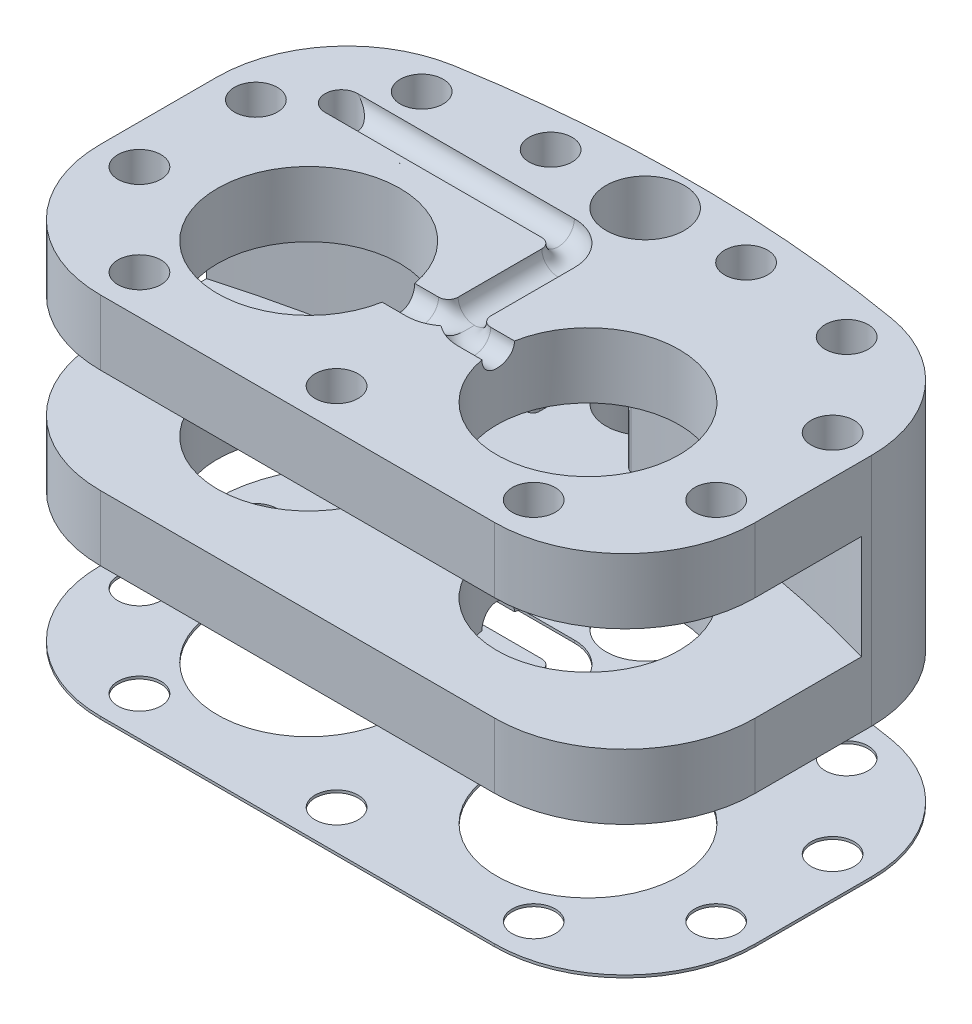
from build123d import *

# Parameters (mm, degrees)
BOSS_EXTRUDE1_DEPTH             = 5
F_12_0MM_DOWEL_HOLE1_D          = 14
BOSS_EXTRUDE2_DEPTH             = 4
F_6_0MM_DOWEL_HOLE1_D           = 6
SKETCH13_R                      = 1.25
SKETCH13_4_R                    = 1.25
FILLET1_R                       = 10
M4X0_7_TAPPED_HOLE1_AT_2_COUNT  = 2
M4X0_7_TAPPED_HOLE1_AT_2_PITCH  = 25.073446611
M4X0_7_TAPPED_HOLE1_AT_3_COUNT  = 2
M4X0_7_TAPPED_HOLE1_AT_3_PITCH  = 32.930809617
M4X0_7_TAPPED_HOLE1_AT_4_COUNT  = 2
M4X0_7_TAPPED_HOLE1_AT_4_PITCH  = 25.111924527
M4X0_7_TAPPED_HOLE1_AT_5_COUNT  = 2
M4X0_7_TAPPED_HOLE1_AT_5_PITCH  = 22.370502293
M4X0_7_TAPPED_HOLE1_AT_6_COUNT  = 2
M4X0_7_TAPPED_HOLE1_AT_6_PITCH  = 16.667429732
M4X0_7_TAPPED_HOLE1_AT_7_COUNT  = 2
M4X0_7_TAPPED_HOLE1_AT_7_PITCH  = 8.870903554
M4X0_7_TAPPED_HOLE1_AT_8_COUNT  = 2
M4X0_7_TAPPED_HOLE1_AT_8_PITCH  = 23.828688167
M4X0_7_TAPPED_HOLE1_AT_9_COUNT  = 2
M4X0_7_TAPPED_HOLE1_AT_9_PITCH  = 30.686033996
M4X0_7_TAPPED_HOLE1_AT_10_COUNT = 2
M4X0_7_TAPPED_HOLE1_AT_10_PITCH = 34.121383931
M4X0_7_TAPPED_HOLE1_AT_11_COUNT = 2
M4X0_7_TAPPED_HOLE1_AT_11_PITCH = 15
FILLET2_R                       = 0.5
THICKEN1_START                  = -10.2
THICKEN1_OUTLINE_R              = 1.65
THICKEN1_OUTLINE_R_2            = 3
THICKEN1_DEPTH                  = 0.2
SKETCH14_W                      = 6
SKETCH14_H                      = 4
CUT_EXTRUDE1_DEPTH              = 10
FILLET3_R                       = 1


# Read off the part's stored shape, not the designer's step: Thicken1
with BuildPart() as part:
    # Sketch2 → Boss-Extrude1 (new body)
    with BuildSketch(Plane(origin=(0, 0, 0), x_dir=(1, 0, 0), z_dir=(0, 1, 0))):
        with BuildLine():
            Line((-25.127648951, 69.819630142), (25.127648951, 69.819630142))
            Line((25.127648951, 69.819630142), (25.127648951, 96.828075976))
            ThreePointArc((25.127648951, 96.828075976), (0, 100.035368941), (-25.127648951, 96.828075976))
            Line((-25.127648951, 96.828075976), (-25.127648951, 69.819630142))
        make_face()
    boss_extrude1 = extrude(amount=BOSS_EXTRUDE1_DEPTH)

    # Ø12.0mm Dowel Hole1 (through all)
    with Locations(Plane(origin=(0, 5, 0), x_dir=(1, 0, 0), z_dir=(0, 1, 0))):
        with Locations((-10.716200381, 81.397623119), (10.716200381, 81.397623119)):
            f_12_0mm_dowel_hole1 = Hole(F_12_0MM_DOWEL_HOLE1_D / 2)

    # Sketch6 → Boss-Extrude2 (add)
    with BuildSketch(Plane(origin=(0, 5, 0), x_dir=(1, 0, 0), z_dir=(0, 1, 0))):
        with BuildLine():
            Line((-3.535368944, 91.431674853), (-3.535368944, 99.972877349))
            ThreePointArc((-3.535368944, 99.972877349), (-14.417509932, 98.990961438), (-25.127648951, 96.828075976))
            Line((-25.127648951, 96.828075976), (-25.127648951, 87.982107603))
            ThreePointArc((-25.127648951, 87.982107603), (-14.434923875, 90.354208384), (-3.535368944, 91.431674853))
        make_face()
        with BuildLine():
            Line((3.535368944, 91.431674853), (3.535368944, 99.972877349))
            ThreePointArc((3.535368944, 99.972877349), (14.417509932, 98.990961438), (25.127648951, 96.828075976))
            Line((25.127648951, 96.828075976), (25.127648951, 87.982107603))
            ThreePointArc((25.127648951, 87.982107603), (14.434923875, 90.354208384), (3.535368944, 91.431674853))
        make_face()
    boss_extrude2 = extrude(amount=BOSS_EXTRUDE2_DEPTH)

    # Ø6.0mm Dowel Hole1 (through all)
    with Locations(Plane(origin=(0, 5, 0), x_dir=(1, 0, 0), z_dir=(0, 1, 0))):
        with Locations((0, 96.5)):
            f_6_0mm_dowel_hole1 = Hole(F_6_0MM_DOWEL_HOLE1_D / 2)

    # Cut-Sweep6: sweep along a curve in space
    with BuildLine() as cut_sweep6_path:
        Line((2, 0, -81.397623119), (10.716200381, 0, -81.397623119))
        ThreePointArc((0, 0, -83.397623119), (0.585786438, 0, -81.983409556), (2, 0, -81.397623119))
        Line((0, 0, -89.819630142), (0, 0, -83.397623119))
        ThreePointArc((-2, 0, -91.819630142), (-0.585786438, 0, -91.233843704), (0, 0, -89.819630142))
        Line((-18.627648951, 0, -91.819630142), (-2, 0, -91.819630142))
        Line((-18.627648951, 0, -91.819630142), (-18.627648951, 9, -91.819630142))
        Line((-18.627648951, 9, -91.819630142), (-25.127648951, 9, -96.828075976))
    # Sketch13 → Cut-Sweep6 (sweep, cut)
    with BuildSketch(Plane(origin=(-13.627648951, 0, 0), x_dir=(0, 0, -1), z_dir=(1, 0, 0))):
        with Locations((91.819630142, 0)):
            Circle(SKETCH13_R)
    cut_sweep6 = sweep(path=cut_sweep6_path.line, transition=Transition.RIGHT, mode=Mode.SUBTRACT)

    # Cut-Sweep7: sweep along a path in Sketch9
    with BuildLine(Plane.XZ) as cut_sweep7_path:
        Line((-10.716200381, -81.397623119), (-2, -81.397623119))
        ThreePointArc((-2, -81.397623119), (-0.585786438, -81.983409556), (0, -83.397623119))
        Line((0, -83.397623119), (0, -89.819630142))
        ThreePointArc((0, -89.819630142), (-0.585786438, -91.233843704), (-2, -91.819630142))
        Line((-2, -91.819630142), (-18.627648951, -91.819630142))
    # Sketch13<4> → Cut-Sweep7 (sweep, cut)
    with BuildSketch(Plane(origin=(-13.627648951, 0, 0), x_dir=(0, 0, -1), z_dir=(1, 0, 0))):
        with Locations((91.819630142, 0)):
            Circle(SKETCH13_4_R)
    cut_sweep7 = sweep(path=cut_sweep7_path.line, mode=Mode.SUBTRACT)

    # Mirror5: Boss-Extrude2 across plane
    add(boss_extrude2.mirror(Plane.ZX.offset(9)))

    # Mirror6: Boss-Extrude1, Ø12.0mm Dowel Hole1, Ø6.0mm Dowel Hole1, Cut-Sweep6, Cut-Sweep7 across plane
    add(boss_extrude1.mirror(Plane.ZX.offset(9)))
    add(f_12_0mm_dowel_hole1.mirror(Plane.ZX.offset(9)), mode=Mode.SUBTRACT)
    add(f_6_0mm_dowel_hole1.mirror(Plane.ZX.offset(9)), mode=Mode.SUBTRACT)
    add(cut_sweep6.mirror(Plane.ZX.offset(9)), mode=Mode.SUBTRACT)
    add(cut_sweep7.mirror(Plane.ZX.offset(9)), mode=Mode.SUBTRACT)

    # Fillet1
    # the kernel refuses this fillet: 10 mm, written as the material it takes off along each edge
    with BuildSketch(Plane(origin=(25.127648951, 43, -69.819630142), x_dir=(-1, 0, 0), z_dir=(0, -1, 0)), Plane(origin=(-25.127648951, 43, -69.819630142), x_dir=(0, 0, -1), z_dir=(0, -1, 0))) as fillet1_piece_1:
        with BuildLine():
            CenterArc((FILLET1_R, FILLET1_R), FILLET1_R, 180, 90)
            Line((0, FILLET1_R), (0, 0))
            Line((0, 0), (FILLET1_R, 0))
        make_face()
    extrude(amount=55, mode=Mode.SUBTRACT)
    with BuildSketch(Plane(origin=(-25.127648951, 39.272938342, -96.828075976), x_dir=(0, 0, 1), z_dir=(0, -1, 0)), Plane(origin=(-25.127648951, 29.022938342, -96.828075976), x_dir=(0, 0, 1), z_dir=(0, -1, 0))) as fillet1_piece_2:
        with BuildLine():
            CenterArc((8.072671085, -10), FILLET1_R, 90, 80.327342931)
            ThreePointArc((-1.785166556, -8.319810411), (-0.981085437, -4.140915459), (0, 0))
            Line((0, 0), (8.072671085, 0))
        make_face()
    extrude(amount=50.295876684, mode=Mode.SUBTRACT)
    with BuildSketch(Plane(origin=(25.127648951, 39.272938342, -96.828075976), x_dir=(-0.9777457958045345, 0, -0.20979313331603044), z_dir=(0, -1, 0))) as fillet1_piece_3:
        with BuildLine():
            CenterArc((8.083866997, -9.990951547), FILLET1_R, 87.562427461, 80.327342931)
            Line((-1.693590961, -7.893020214), (0, 0))
            ThreePointArc((0, 0), (4.254587668, 0.090516533), (8.509175337, 0))
        make_face()
    extrude(amount=60.545876684, mode=Mode.SUBTRACT)
    with BuildSketch(Plane(origin=(25.127648951, -25, -69.819630142), x_dir=(-1, 0, 0), z_dir=(0, 1, 0)), Plane(origin=(-25.127648951, -25, -69.819630142), x_dir=(0, 0, -1), z_dir=(0, 1, 0))) as fillet1_piece_4:
        with BuildLine():
            CenterArc((FILLET1_R, -FILLET1_R), FILLET1_R, 90, 90)
            Line((0, -FILLET1_R), (0, 0))
            Line((0, 0), (FILLET1_R, 0))
        make_face()
    extrude(amount=55, mode=Mode.SUBTRACT)

    # Sketch12 → M4x0.7 Tapped Hole1 (revolve, cut)
    with BuildSketch(Plane(origin=(7.5, 0, -96.745091997), x_dir=(0, 0, -1), z_dir=(1, 0, 0))):
        Polygon((0, 0), (0, 3.491420021), (1.65, 2.5), (1.65, 0), align=None)
    m4x0_7_tapped_hole1 = revolve(axis=Axis((7.5, -6.35, -96.745091997), (0, 1, 0)), mode=Mode.SUBTRACT)

    # M4x0.7 Tapped Hole1 at 2: M4x0.7 Tapped Hole1 ×2
    with Locations(*[Vector(-0.2991212223978009, 0, 0.9542151195151152) * (i * M4X0_7_TAPPED_HOLE1_AT_2_PITCH) for i in range(1, M4X0_7_TAPPED_HOLE1_AT_2_COUNT)]):
        add(m4x0_7_tapped_hole1, mode=Mode.SUBTRACT)

    # M4x0.7 Tapped Hole1 at 3: M4x0.7 Tapped Hole1 ×2
    with Locations(*[Vector(-0.6871270161445325, 0, 0.7265373105934144) * (i * M4X0_7_TAPPED_HOLE1_AT_3_PITCH) for i in range(1, M4X0_7_TAPPED_HOLE1_AT_3_COUNT)]):
        add(m4x0_7_tapped_hole1, mode=Mode.SUBTRACT)

    # M4x0.7 Tapped Hole1 at 4: M4x0.7 Tapped Hole1 ×2
    with Locations(*[Vector(0.3037460925290886, 0, 0.9527530169321483) * (i * M4X0_7_TAPPED_HOLE1_AT_4_PITCH) for i in range(1, M4X0_7_TAPPED_HOLE1_AT_4_COUNT)]):
        add(m4x0_7_tapped_hole1, mode=Mode.SUBTRACT)

    # M4x0.7 Tapped Hole1 at 5: M4x0.7 Tapped Hole1 ×2
    with Locations(*[Vector(0.6538811136083568, 0, 0.7565973098460602) * (i * M4X0_7_TAPPED_HOLE1_AT_5_PITCH) for i in range(1, M4X0_7_TAPPED_HOLE1_AT_5_COUNT)]):
        add(m4x0_7_tapped_hole1, mode=Mode.SUBTRACT)

    # M4x0.7 Tapped Hole1 at 6: M4x0.7 Tapped Hole1 ×2
    with Locations(*[Vector(0.8776187562376473, 0, 0.4793592793509739) * (i * M4X0_7_TAPPED_HOLE1_AT_6_PITCH) for i in range(1, M4X0_7_TAPPED_HOLE1_AT_6_COUNT)]):
        add(m4x0_7_tapped_hole1, mode=Mode.SUBTRACT)

    # M4x0.7 Tapped Hole1 at 7: M4x0.7 Tapped Hole1 ×2
    with Locations(*[Vector(0.9924334775780699, 0, 0.12278351918029798) * (i * M4X0_7_TAPPED_HOLE1_AT_7_PITCH) for i in range(1, M4X0_7_TAPPED_HOLE1_AT_7_COUNT)]):
        add(m4x0_7_tapped_hole1, mode=Mode.SUBTRACT)

    # M4x0.7 Tapped Hole1 at 8: M4x0.7 Tapped Hole1 ×2
    with Locations(*[Vector(-0.9989547681528992, 0, 0.04570963995250205) * (i * M4X0_7_TAPPED_HOLE1_AT_8_PITCH) for i in range(1, M4X0_7_TAPPED_HOLE1_AT_8_COUNT)]):
        add(m4x0_7_tapped_hole1, mode=Mode.SUBTRACT)

    # M4x0.7 Tapped Hole1 at 9: M4x0.7 Tapped Hole1 ×2
    with Locations(*[Vector(-0.9655092266057976, 0, 0.2603688409527429) * (i * M4X0_7_TAPPED_HOLE1_AT_9_PITCH) for i in range(1, M4X0_7_TAPPED_HOLE1_AT_9_COUNT)]):
        add(m4x0_7_tapped_hole1, mode=Mode.SUBTRACT)

    # M4x0.7 Tapped Hole1 at 10: M4x0.7 Tapped Hole1 ×2
    with Locations(*[Vector(-0.868301502984496, 0, 0.49603679290438246) * (i * M4X0_7_TAPPED_HOLE1_AT_10_PITCH) for i in range(1, M4X0_7_TAPPED_HOLE1_AT_10_COUNT)]):
        add(m4x0_7_tapped_hole1, mode=Mode.SUBTRACT)

    # M4x0.7 Tapped Hole1 at 11: M4x0.7 Tapped Hole1 ×2
    with Locations(*[(-i * M4X0_7_TAPPED_HOLE1_AT_11_PITCH, 0, 0) for i in range(1, M4X0_7_TAPPED_HOLE1_AT_11_COUNT)]):
        add(m4x0_7_tapped_hole1, mode=Mode.SUBTRACT)

    # Mirror7: M4x0.7 Tapped Hole1 across plane
    add(m4x0_7_tapped_hole1.mirror(Plane.ZX.offset(9)), mode=Mode.SUBTRACT)

    # Mirror7 copy 1 sketch → Mirror7 copy 1 (revolve, cut)
    with BuildSketch(Plane(origin=(0, 18, -72.819630142), x_dir=(0, 0, -1), z_dir=(1, 0, 0))):
        Polygon((0, 0), (0, -3.491420021), (1.65, -2.5), (1.65, 0), align=None)
    revolve(axis=Axis((0, 24.35, -72.819630142), (0, 1, 0)), mode=Mode.SUBTRACT)

    # Mirror7 copy 2 sketch → Mirror7 copy 2 (revolve, cut)
    with BuildSketch(Plane(origin=(-15.127648951, 18, -72.819630142), x_dir=(0, 0, -1), z_dir=(1, 0, 0))):
        Polygon((0, 0), (0, -3.491420021), (1.65, -2.5), (1.65, 0), align=None)
    revolve(axis=Axis((-15.127648951, 24.35, -72.819630142), (0, 1, 0)), mode=Mode.SUBTRACT)

    # Mirror7 copy 3 sketch → Mirror7 copy 3 (revolve, cut)
    with BuildSketch(Plane(origin=(15.127648951, 18, -72.819630142), x_dir=(0, 0, -1), z_dir=(1, 0, 0))):
        Polygon((0, 0), (0, -3.491420021), (1.65, -2.5), (1.65, 0), align=None)
    revolve(axis=Axis((15.127648951, 24.35, -72.819630142), (0, 1, 0)), mode=Mode.SUBTRACT)

    # Mirror7 copy 4 sketch → Mirror7 copy 4 (revolve, cut)
    with BuildSketch(Plane(origin=(22.127648951, 18, -79.819630142), x_dir=(0, 0, -1), z_dir=(1, 0, 0))):
        Polygon((0, 0), (0, -3.491420021), (1.65, -2.5), (1.65, 0), align=None)
    revolve(axis=Axis((22.127648951, 24.35, -79.819630142), (0, 1, 0)), mode=Mode.SUBTRACT)

    # Mirror7 copy 5 sketch → Mirror7 copy 5 (revolve, cut)
    with BuildSketch(Plane(origin=(22.127648951, 18, -88.755404892), x_dir=(0, 0, -1), z_dir=(1, 0, 0))):
        Polygon((0, 0), (0, -3.491420021), (1.65, -2.5), (1.65, 0), align=None)
    revolve(axis=Axis((22.127648951, 24.35, -88.755404892), (0, 1, 0)), mode=Mode.SUBTRACT)

    # Mirror7 copy 6 sketch → Mirror7 copy 6 (revolve, cut)
    with BuildSketch(Plane(origin=(16.303781663, 18, -95.65589124), x_dir=(0, 0, -1), z_dir=(1, 0, 0))):
        Polygon((0, 0), (0, -3.491420021), (1.65, -2.5), (1.65, 0), align=None)
    revolve(axis=Axis((16.303781663, 24.35, -95.65589124), (0, 1, 0)), mode=Mode.SUBTRACT)

    # Mirror7 copy 7 sketch → Mirror7 copy 7 (revolve, cut)
    with BuildSketch(Plane(origin=(-16.303781663, 18, -95.65589124), x_dir=(0, 0, -1), z_dir=(1, 0, 0))):
        Polygon((0, 0), (0, -3.491420021), (1.65, -2.5), (1.65, 0), align=None)
    revolve(axis=Axis((-16.303781663, 24.35, -95.65589124), (0, 1, 0)), mode=Mode.SUBTRACT)

    # Mirror7 copy 8 sketch → Mirror7 copy 8 (revolve, cut)
    with BuildSketch(Plane(origin=(-22.127648951, 18, -88.755404892), x_dir=(0, 0, -1), z_dir=(1, 0, 0))):
        Polygon((0, 0), (0, -3.491420021), (1.65, -2.5), (1.65, 0), align=None)
    revolve(axis=Axis((-22.127648951, 24.35, -88.755404892), (0, 1, 0)), mode=Mode.SUBTRACT)

    # Mirror7 copy 9 sketch → Mirror7 copy 9 (revolve, cut)
    with BuildSketch(Plane(origin=(-22.127648951, 18, -79.819630142), x_dir=(0, 0, -1), z_dir=(1, 0, 0))):
        Polygon((0, 0), (0, -3.491420021), (1.65, -2.5), (1.65, 0), align=None)
    revolve(axis=Axis((-22.127648951, 24.35, -79.819630142), (0, 1, 0)), mode=Mode.SUBTRACT)

    # Mirror7 copy 10 sketch → Mirror7 copy 10 (revolve, cut)
    with BuildSketch(Plane(origin=(-7.5, 18, -96.745091997), x_dir=(0, 0, -1), z_dir=(1, 0, 0))):
        Polygon((0, 0), (0, -3.491420021), (1.65, -2.5), (1.65, 0), align=None)
    revolve(axis=Axis((-7.5, 24.35, -96.745091997), (0, 1, 0)), mode=Mode.SUBTRACT)

    # Fillet2
    fillet2_edges = [part.edges().sort_by_distance(p)[0] for p in [
        (-3.535368944, 9, -91.431674853),
        (3.535368944, 9, -91.431674853),
    ]]
    fillet(fillet2_edges, radius=FILLET2_R)


with BuildPart() as body_2:
    # Thicken1 outline → Thicken1 (new body)
    with BuildSketch(Plane(origin=(0, 0, 0), x_dir=(1, 0, 0), z_dir=(0, 1, 0)).offset(THICKEN1_START)):
        with BuildLine():
            Line((25.127648951, 79.819630142), (25.127648951, 88.755404892))
            ThreePointArc((25.127648951, 88.755404892), (22.769700243, 95.205137604), (16.80783854, 98.613242532))
            ThreePointArc((16.80783854, 98.613242532), (0, 100.035368941), (-16.80783854, 98.613242532))
            ThreePointArc((-16.80783854, 98.613242532), (-22.769700243, 95.205137604), (-25.127648951, 88.755404892))
            Line((-25.127648951, 88.755404892), (-25.127648951, 79.819630142))
            ThreePointArc((-25.127648951, 79.819630142), (-22.198716763, 72.74856233), (-15.127648951, 69.819630142))
            Line((-15.127648951, 69.819630142), (15.127648951, 69.819630142))
            ThreePointArc((15.127648951, 69.819630142), (22.198716763, 72.74856233), (25.127648951, 79.819630142))
        make_face()
        with Locations((-15.127648951, 72.819630142)):
            Circle(THICKEN1_OUTLINE_R, mode=Mode.SUBTRACT)
        with Locations((-22.127648951, 79.819630142)):
            Circle(THICKEN1_OUTLINE_R, mode=Mode.SUBTRACT)
        with BuildLine():
            ThreePointArc((2, 80.147623119), (0.942443263, 80.324501945), (0, 80.835885427))
            ThreePointArc((0, 80.835885427), (-0.942443263, 80.324501945), (-2, 80.147623119))
            Line((-2, 80.147623119), (-3.828711724, 80.147623119))
            ThreePointArc((-3.828711724, 80.147623119), (-17.716200381, 81.397623119), (-3.828711724, 82.647623119))
            Line((-3.828711724, 82.647623119), (-2, 82.647623119))
            ThreePointArc((-2, 82.647623119), (-1.469669914, 82.867293033), (-1.25, 83.397623119))
            Line((-1.25, 83.397623119), (-1.25, 89.819630142))
            ThreePointArc((-1.25, 89.819630142), (-1.469669914, 90.349960228), (-2, 90.569630142))
            Line((-2, 90.569630142), (-18.627648951, 90.569630142))
            ThreePointArc((-18.627648951, 90.569630142), (-19.877648951, 91.819630142), (-18.627648951, 93.069630142))
            Line((-18.627648951, 93.069630142), (-2, 93.069630142))
            ThreePointArc((-2, 93.069630142), (0.298097039, 92.117727181), (1.25, 89.819630142))
            Line((1.25, 89.819630142), (1.25, 83.397623119))
            ThreePointArc((1.25, 83.397623119), (1.469669914, 82.867293033), (2, 82.647623119))
            Line((2, 82.647623119), (3.828711724, 82.647623119))
            ThreePointArc((3.828711724, 82.647623119), (17.716200381, 81.397623119), (3.828711724, 80.147623119))
            Line((3.828711724, 80.147623119), (2, 80.147623119))
        make_face(mode=Mode.SUBTRACT)
        with Locations((0, 72.819630142)):
            Circle(THICKEN1_OUTLINE_R, mode=Mode.SUBTRACT)
        with Locations((15.127648951, 72.819630142)):
            Circle(THICKEN1_OUTLINE_R, mode=Mode.SUBTRACT)
        with Locations((22.127648951, 79.819630142)):
            Circle(THICKEN1_OUTLINE_R, mode=Mode.SUBTRACT)
        with Locations((-22.127648951, 88.755404892)):
            Circle(THICKEN1_OUTLINE_R, mode=Mode.SUBTRACT)
        with Locations((-16.303781663, 95.65589124)):
            Circle(THICKEN1_OUTLINE_R, mode=Mode.SUBTRACT)
        with Locations((-7.5, 96.745091997)):
            Circle(THICKEN1_OUTLINE_R, mode=Mode.SUBTRACT)
        with Locations((22.127648951, 88.755404892)):
            Circle(THICKEN1_OUTLINE_R, mode=Mode.SUBTRACT)
        with Locations((0, 96.5)):
            Circle(THICKEN1_OUTLINE_R_2, mode=Mode.SUBTRACT)
        with Locations((7.5, 96.745091997)):
            Circle(THICKEN1_OUTLINE_R, mode=Mode.SUBTRACT)
        with Locations((16.303781663, 95.65589124)):
            Circle(THICKEN1_OUTLINE_R, mode=Mode.SUBTRACT)
    extrude(amount=THICKEN1_DEPTH)

    # Sketch14 → Cut-Extrude1 (cut)
    with BuildSketch(Plane(origin=(0, -10, 0), x_dir=(1, 0, 0), z_dir=(0, 1, 0))):
        with Locations((0, 98.5)):
            Rectangle(SKETCH14_W, SKETCH14_H)
    extrude(amount=-CUT_EXTRUDE1_DEPTH, mode=Mode.SUBTRACT)

    # Fillet3
    fillet3_edges = [body_2.edges().sort_by_distance(p)[0] for p in [
        (-3, -10.1, -99.990374733),
        (3, -10.1, -99.990374733),
    ]]
    fillet(fillet3_edges, radius=FILLET3_R)


solid = Compound([part.part, body_2.part])
